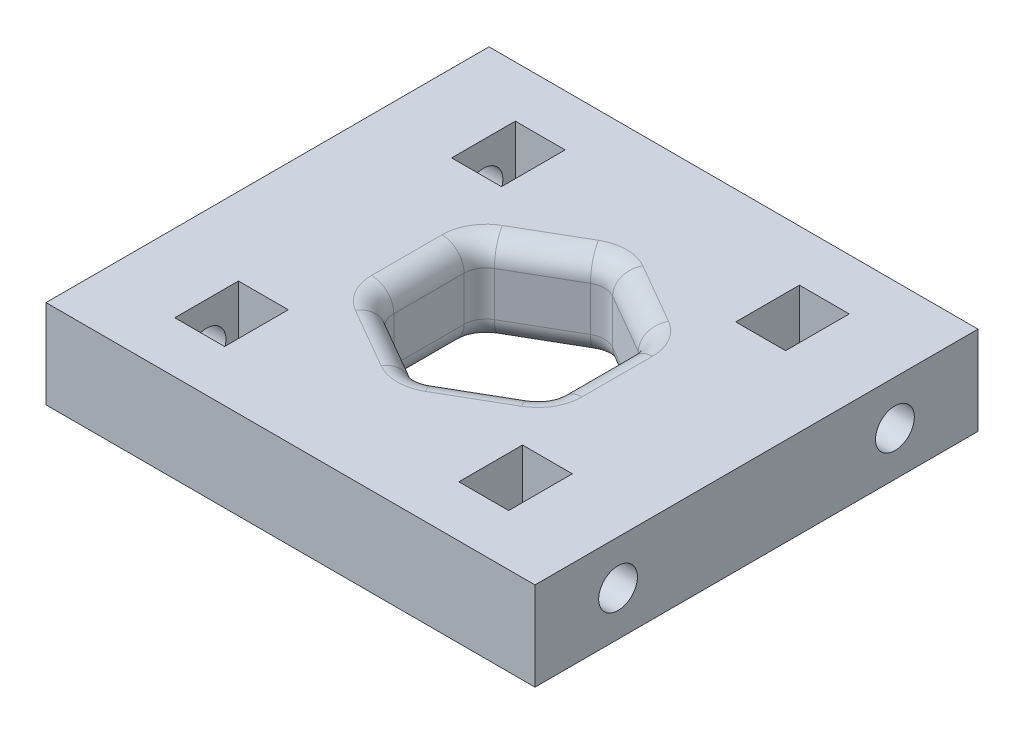
from build123d import *

# Parameters (mm, degrees)
SKETCH1_W           = 40
SKETCH1_H           = 8
BOSS_EXTRUDE1_DEPTH = 22.075
SKETCH2_R           = 1.75
CUT_EXTRUDE1_DEPTH  = 7
CUT_EXTRUDE2_DEPTH  = 4.5
CUT_EXTRUDE3_REACH  = 32.843
FILLET1_R           = 2


with BuildPart() as part:
    # Sketch1 → Boss-Extrude1 (new, symmetric)
    with BuildSketch(Plane(origin=(0, 0, 0), x_dir=(0, 0, -1), z_dir=(1, 0, 0))):
        Rectangle(SKETCH1_W, SKETCH1_H)
    extrude(amount=BOSS_EXTRUDE1_DEPTH, both=True)

    # Sketch2 → Cut-Extrude1 (cut)
    with BuildSketch(Plane(origin=(22.075, 0, 0), x_dir=(0, 0, -1), z_dir=(1, 0, 0))):
        with Locations((-12.5, 0)):
            Circle(SKETCH2_R)
        with Locations((12.5, 0)):
            Circle(SKETCH2_R)
    cut_extrude1 = extrude(amount=-CUT_EXTRUDE1_DEPTH, mode=Mode.SUBTRACT)

    # Sketch3 → Cut-Extrude2 (cut)
    with BuildSketch(Plane(origin=(15.075, 0, 0), x_dir=(0, 0, -1), z_dir=(1, 0, 0))):
        Polygon((-15.375, 4), (-15.375, -1.659882024), (-12.5, -3.319764048), (-9.625, -1.659882024), (-9.625, 4), align=None)
        Polygon((15.375, 4), (9.625, 4), (9.625, -1.659882024), (12.5, -3.319764048), (15.375, -1.659882024), align=None)
    cut_extrude2 = extrude(amount=-CUT_EXTRUDE2_DEPTH, mode=Mode.SUBTRACT)

    # Mirror1: Cut-Extrude1, Cut-Extrude2 across plane
    add(cut_extrude1.mirror(Plane(origin=(0, 0, 0), x_dir=(0, 0, 1), z_dir=(1, 0, 0))), mode=Mode.SUBTRACT)
    add(cut_extrude2.mirror(Plane(origin=(0, 0, 0), x_dir=(0, 0, 1), z_dir=(1, 0, 0))), mode=Mode.SUBTRACT)

    # Sketch4 → Cut-Extrude3 (cut, up to next)
    with BuildSketch(Plane(origin=(0, 4, 0), x_dir=(1, 0, 0), z_dir=(0, 1, 0)), mode=Mode.PRIVATE) as cut_extrude3_sk1:
        Polygon((0, -8.660254038), (7.5, -4.330127019), (7.5, 4.330127019), (0, 8.660254038), (-7.5, 4.330127019), (-7.5, -4.330127019), align=None)
    cut_extrude3_tool1 = extrude(cut_extrude3_sk1.sketch, amount=-CUT_EXTRUDE3_REACH, mode=Mode.PRIVATE) & part.part
    add(cut_extrude3_tool1.solids().sort_by_distance((0, 4, 0))[0], mode=Mode.SUBTRACT)

    # Fillet1
    fillet1_edges = [part.edges().sort_by_distance(p)[0] for p in [
        (7.5, 4, 0),
        (7.5, -4, 0),
        (7.5, 0, 4.330127019),
        (3.75, 4, 6.495190528),
        (3.75, -4, 6.495190528),
        (0, 0, 8.660254038),
        (-3.75, 4, 6.495190528),
        (-3.75, -4, 6.495190528),
        (-7.5, 0, 4.330127019),
        (-7.5, 4, 0),
        (-7.5, -4, 0),
        (-7.5, 0, -4.330127019),
        (-3.75, 4, -6.495190528),
        (-3.75, -4, -6.495190528),
        (0, 0, -8.660254038),
        (3.75, 4, -6.495190528),
        (7.5, 0, -4.330127019),
        (3.75, -4, -6.495190528),
    ]]
    fillet(fillet1_edges, radius=FILLET1_R)


solid = part.part
